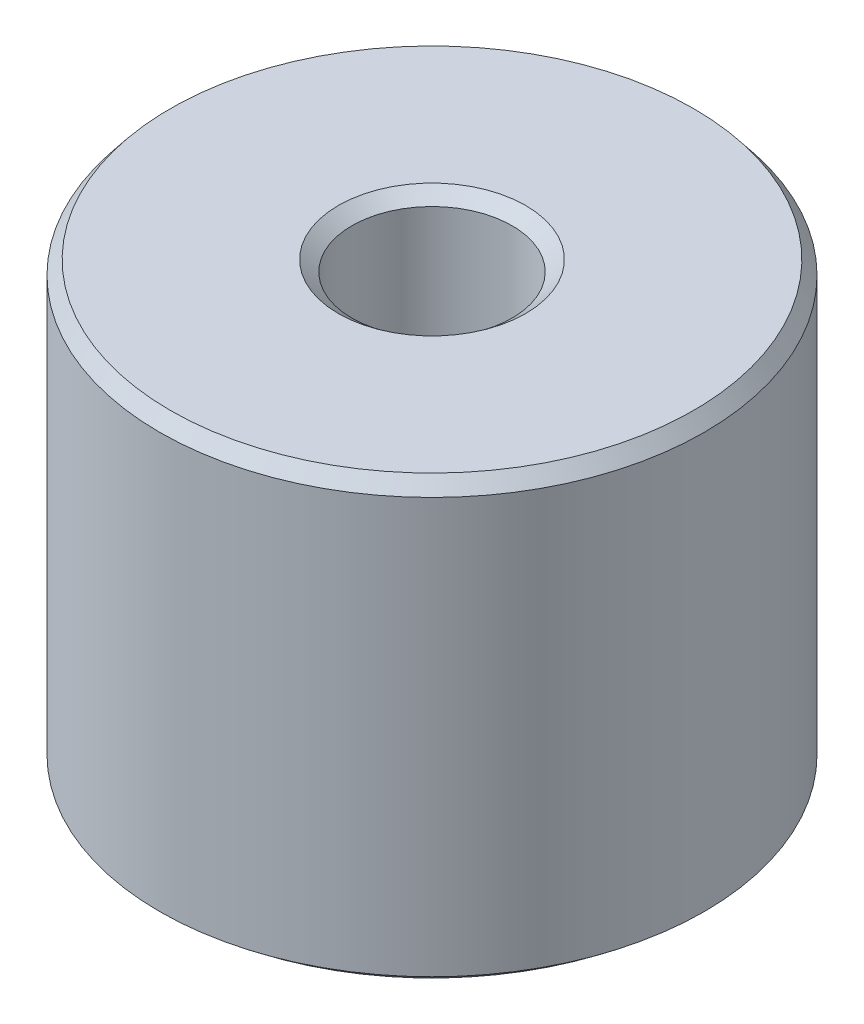
from build123d import *
from OCP.BRepFilletAPI import BRepFilletAPI_MakeChamfer

# Parameters (mm, degrees)
SKETCH1_R           = 7.5
BOSS_EXTRUDE1_DEPTH = 12.102922807
SKETCH2_R           = 2.206313965
CUT_EXTRUDE1_DEPTH  = 17.092878564
CHAMFER1_SIZE       = 0.37352829
CHAMFER1_SIZE2      = 0.295401028


with BuildPart() as part:
    # Sketch1 → Boss-Extrude1 (new body)
    with BuildSketch(Plane(origin=(0, 0, 0), x_dir=(1, 0, 0), z_dir=(0, 1, 0))):
        Circle(SKETCH1_R)
    extrude(amount=BOSS_EXTRUDE1_DEPTH)

    # Sketch2 → Cut-Extrude1 (cut, through all)
    with BuildSketch(Plane(origin=(0, 0, 0), x_dir=(1, 0, 0), z_dir=(0, 1, 0))):
        Circle(SKETCH2_R)
    extrude(amount=CUT_EXTRUDE1_DEPTH, mode=Mode.SUBTRACT)

    # Chamfer1: one chamfer whose edges measure the first distance from different faces: ONE call of the kernel's chamfer builder (chamfer() names one face for all edges)
    chamfer1_edges_1 = [part.edges().sort_by_distance(p)[0] for p in [
        (-2.206313965, 12.102922807, 0),
    ]]
    chamfer1_side_1 = [part.faces().sort_by_distance(p)[0] for p in [
        (-7.287867966, 12.102922807, 0),
    ]]
    chamfer1_edges_2 = [part.edges().sort_by_distance(p)[0] for p in [
        (-2.206313965, 0, 0),
    ]]
    chamfer1_side_2 = [part.faces().sort_by_distance(p)[0] for p in [
        (-2.206313965, 6.051461403, 0),
    ]]
    chamfer1_edges_3 = [part.edges().sort_by_distance(p)[0] for p in [
        (-7.5, 0, 0),
    ]]
    chamfer1_side_3 = [part.faces().sort_by_distance(p)[0] for p in [
        (-7.287867966, 0, 0),
    ]]
    chamfer1_edges_4 = [part.edges().sort_by_distance(p)[0] for p in [
        (-7.5, 12.102922807, 0),
    ]]
    chamfer1_side_4 = [part.faces().sort_by_distance(p)[0] for p in [
        (-7.5, 6.051461403, 0),
    ]]
    chamfer1 = BRepFilletAPI_MakeChamfer(part.part.solid().wrapped)
    for e in chamfer1_edges_1:
        chamfer1.Add(CHAMFER1_SIZE, CHAMFER1_SIZE2, e.wrapped, chamfer1_side_1[0].wrapped)  # the first distance lies on this face
    for e in chamfer1_edges_2:
        chamfer1.Add(CHAMFER1_SIZE, CHAMFER1_SIZE2, e.wrapped, chamfer1_side_2[0].wrapped)  # the first distance lies on this face
    for e in chamfer1_edges_3:
        chamfer1.Add(CHAMFER1_SIZE, CHAMFER1_SIZE2, e.wrapped, chamfer1_side_3[0].wrapped)  # the first distance lies on this face
    for e in chamfer1_edges_4:
        chamfer1.Add(CHAMFER1_SIZE, CHAMFER1_SIZE2, e.wrapped, chamfer1_side_4[0].wrapped)  # the first distance lies on this face
    add(Compound.cast(chamfer1.Shape()), mode=Mode.REPLACE)


solid = part.part
